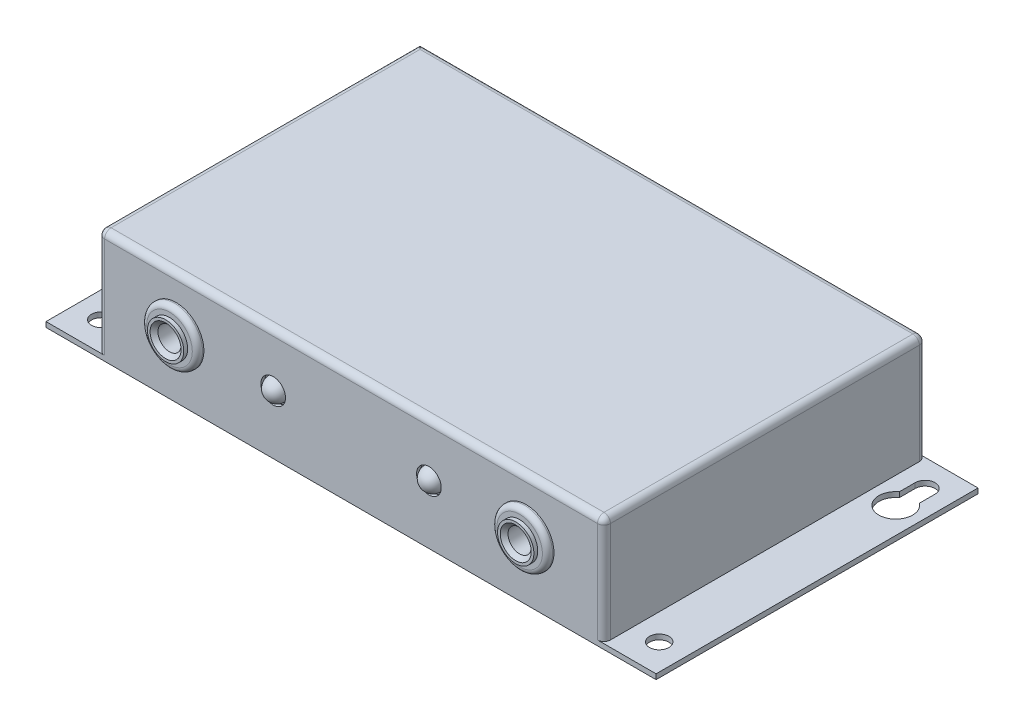
from build123d import *

# Parameters (mm, degrees)
SKETCH1_W           = 99
SKETCH1_H           = 63
BOSS_EXTRUDE1_DEPTH = 22
SKETCH5_W           = 10.2
SKETCH5_H           = 63
BOSS_EXTRUDE3_DEPTH = 1
SKETCH7_R           = 1.9
CUT_EXTRUDE2_DEPTH  = 1
SKETCH8_R           = 5.461
BOSS_EXTRUDE4_DEPTH = 1.27
SKETCH9_R           = 3.556
SKETCH9_R_2         = 2.032
BOSS_EXTRUDE5_DEPTH = 0.762
FILLET1_R           = 1
CHAMFER1_SIZE       = 1
SKETCH10_R          = 2.27
CUT_EXTRUDE3_DEPTH  = 20
SKETCH11_R          = 2.413
CUT_EXTRUDE4_DEPTH  = 0.762
FILLET3_R           = 1.27


with BuildPart() as part:
    # Sketch1 → Boss-Extrude1 (new body)
    with BuildSketch(Plane(origin=(0, 0, 0), x_dir=(1, 0, 0), z_dir=(0, 1, 0))):
        with Locations((49.5, 31.5)):
            Rectangle(SKETCH1_W, SKETCH1_H)
    extrude(amount=BOSS_EXTRUDE1_DEPTH)

    # Sketch5 → Boss-Extrude3 (add)
    with BuildSketch(Plane.XZ):
        with Locations((-5.1, -31.5)):
            Rectangle(SKETCH5_W, SKETCH5_H)
        with Locations((104.1, -31.5)):
            Rectangle(SKETCH5_W, SKETCH5_H)
    extrude(amount=-BOSS_EXTRUDE3_DEPTH)

    # Sketch7 → Cut-Extrude2 (cut)
    with BuildSketch(Plane(origin=(0, 1, 0), x_dir=(1, 0, 0), z_dir=(0, 1, 0))):
        with Locations(Location((104.1, 5.71, 0), (0, 0, 270))):
            Circle(SKETCH7_R)
        with Locations(Location((-5.1, 5.71, 0), (0, 0, 270))):
            Circle(SKETCH7_R)
        with BuildLine():
            Line((102.15, 57.75), (102.15, 54.662235902))
            ThreePointArc((102.15, 54.662235902), (104.1, 48.7), (106.05, 54.662235902))
            Line((106.05, 54.662235902), (106.05, 57.75))
            ThreePointArc((106.05, 57.75), (104.1, 59.7), (102.15, 57.75))
        make_face()
        with BuildLine():
            Line((-7.05, 57.75), (-7.05, 54.662235902))
            ThreePointArc((-7.05, 54.662235902), (-5.1, 48.7), (-3.15, 54.662235902))
            Line((-3.15, 54.662235902), (-3.15, 57.75))
            ThreePointArc((-3.15, 57.75), (-5.1, 59.7), (-7.05, 57.75))
        make_face()
    extrude(amount=-CUT_EXTRUDE2_DEPTH, mode=Mode.SUBTRACT)

    # Sketch8 → Boss-Extrude4 (add)
    with BuildSketch(Plane.XY):
        with Locations(Location((15.24, 11.5, 0), (0, 0, 180))):
            Circle(SKETCH8_R)
        with Locations(Location((83.76, 11.5, 0), (0, 0, 180))):
            Circle(SKETCH8_R)
    extrude(amount=BOSS_EXTRUDE4_DEPTH)

    # Sketch9 → Boss-Extrude5 (add)
    # profile 1 of 2: a face of its own
    with BuildSketch(Plane.XY.offset(1.27)):
        with Locations(Location((15.24, 11.5, 0), (0, 0, 180))):
            Circle(SKETCH9_R)
        with Locations(Location((15.24, 11.5, 0), (0, 0, 180))):
            Circle(SKETCH9_R_2, mode=Mode.SUBTRACT)
    # profile 2 of 2: a face of its own
    with BuildSketch(Plane.XY.offset(1.27)):
        with Locations(Location((83.76, 11.5, 0), (0, 0, 180))):
            Circle(SKETCH9_R)
        with Locations(Location((83.76, 11.5, 0), (0, 0, 180))):
            Circle(SKETCH9_R_2, mode=Mode.SUBTRACT)
    extrude(amount=BOSS_EXTRUDE5_DEPTH)

    # Fillet1
    fillet1_edges = [part.edges().sort_by_distance(p)[0] for p in [
        (20.701, 11.5, 1.27),
        (89.221, 11.5, 1.27),
    ]]
    fillet(fillet1_edges, radius=FILLET1_R)

    # Chamfer1
    # the kernel refuses this chamfer: 1 mm, written as the material it takes off along each edge
    with BuildSketch(Plane(origin=(83.76, 11.5, 2.032), x_dir=(-1, 0, 0), z_dir=(0, 1, 0))) as chamfer1_piece_1_section:
        Polygon((2.032 + CHAMFER1_SIZE, 0), (2.032, -CHAMFER1_SIZE), (2.032, 0), align=None)
    chamfer1_piece_1 = revolve(axis=Axis((83.76, 11.5, 2.032), (0, 0, 1)), mode=Mode.PRIVATE)
    chamfer1_piece_1 = split(chamfer1_piece_1, bisect_by=Plane(origin=(86.411200438, 11.5, 1.27), z_dir=(0, 0, 1)), keep=Keep.TOP, mode=Mode.PRIVATE)
    add(chamfer1_piece_1, mode=Mode.SUBTRACT)
    with BuildSketch(Plane(origin=(15.24, 11.5, 2.032), x_dir=(-1, 0, 0), z_dir=(0, 1, 0))) as chamfer1_piece_2_section:
        Polygon((2.032 + CHAMFER1_SIZE, 0), (2.032, -CHAMFER1_SIZE), (2.032, 0), align=None)
    chamfer1_piece_2 = revolve(axis=Axis((15.24, 11.5, 2.032), (0, 0, 1)), mode=Mode.PRIVATE)
    chamfer1_piece_2 = split(chamfer1_piece_2, bisect_by=Plane(origin=(17.891200438, 11.5, 1.27), z_dir=(0, 0, 1)), keep=Keep.TOP, mode=Mode.PRIVATE)
    add(chamfer1_piece_2, mode=Mode.SUBTRACT)

    # Sketch10 → Cut-Extrude3 (cut)
    with BuildSketch(Plane.XY.offset(1.27)):
        with Locations((15.24, 11.5)):
            Circle(SKETCH10_R)
        with Locations((83.76, 11.5)):
            Circle(SKETCH10_R)
    extrude(amount=-CUT_EXTRUDE3_DEPTH, mode=Mode.SUBTRACT)

    # Sketch11 → Cut-Extrude4 (cut)
    with BuildSketch(Plane.XY):
        with Locations((34.26, 11.5)):
            Circle(SKETCH11_R)
        with Locations((64.74, 11.5)):
            Circle(SKETCH11_R)
    extrude(amount=-CUT_EXTRUDE4_DEPTH, mode=Mode.SUBTRACT)

    # Sketch13 → Revolve1 (revolve)
    with BuildSketch(Plane(origin=(34.26, 11.5, -0.762), x_dir=(1, 0, 0), z_dir=(0, 1, 0))):
        with BuildLine():
            Line((0, 2.159), (0, -2.159))
            ThreePointArc((0, -2.159), (2.159, 0), (0, 2.159))
        make_face()
    revolve(axis=Axis((34.26, 11.5, -2.921), (0, 0, -1)))

    # Sketch15 → Revolve2 (revolve)
    with BuildSketch(Plane(origin=(34.26, 11.5, -0.762), x_dir=(1, 0, 0), z_dir=(0, 1, 0))):
        with BuildLine():
            Line((30.48, -2.159), (30.48, 2.159))
            ThreePointArc((30.48, 2.159), (32.639, 0), (30.48, -2.159))
        make_face()
    revolve(axis=Axis((64.74, 11.5, -2.921), (0, 0, -1)))

    # Fillet3
    fillet3_edges = [part.edges().sort_by_distance(p)[0] for p in [
        (99, 22, -31.5),
        (49.5, 22, -63),
        (0, 22, -31.5),
        (99, 11.5, -63),
        (99, 11.5, 0),
        (0, 11.5, 0),
        (49.5, 22, 0),
    ]]
    fillet(fillet3_edges, radius=FILLET3_R)


solid = part.part
